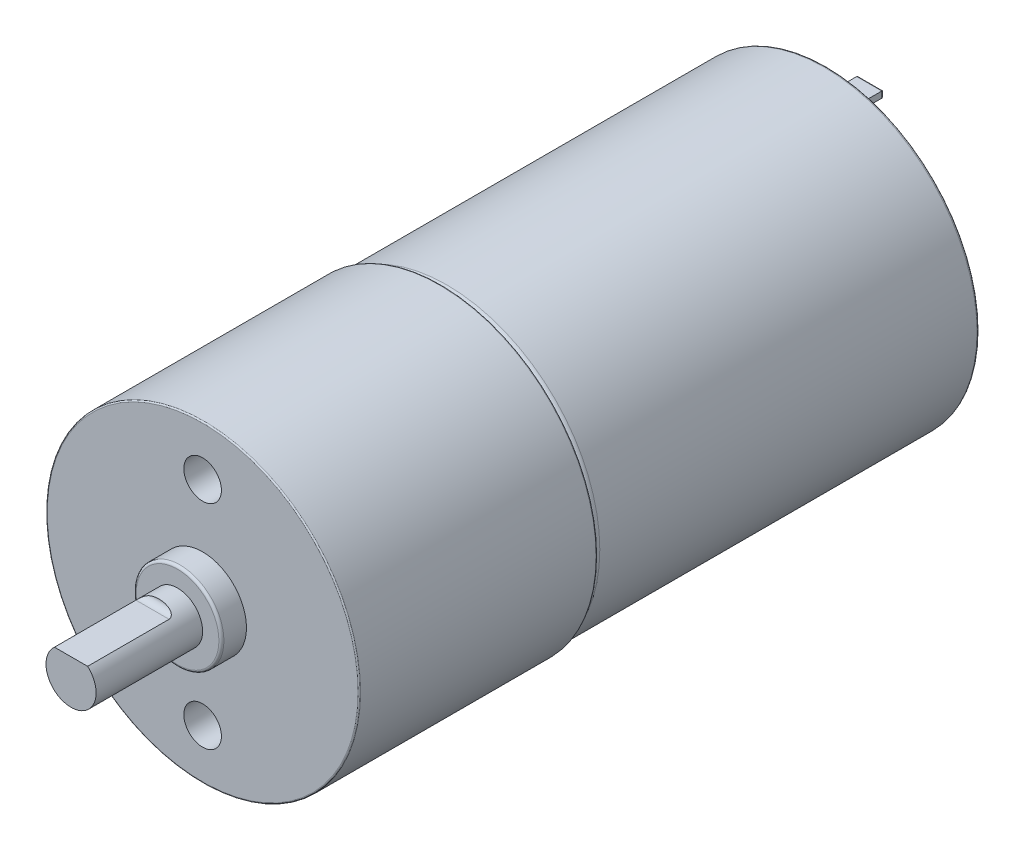
from build123d import *

# Parameters (mm, degrees)
IZIM2_R                     = 12.2
Y_KSEKLIK_EKSTR_ZYON1_DEPTH = 30.8
RADYUS1_R                   = 0.5
IZIM3_R                     = 12.5
Y_KSEKLIK_EKSTR_ZYON2_DEPTH = 19
IZIM4_R                     = 3.5
Y_KSEKLIK_EKSTR_ZYON3_DEPTH = 2
IZIM5_R                     = 3.225
Y_KSEKLIK_EKSTR_ZYON4_DEPTH = 1.7
IZIM6_R                     = 2
Y_KSEKLIK_EKSTR_ZYON5_DEPTH = 8.5
KES_EKSTR_ZYON1_START       = -7
KES_EKSTR_ZYON1_DEPTH       = 7
RADYUS2_R                   = 0.5
RADYUS3_R                   = 0.2
RADYUS4_R                   = 0.3
RADYUS5_R                   = 0.2
RADYUS6_R                   = 0.1
RADYUS7_R                   = 0.1
IZIM8_R                     = 1.5
KES_EKSTR_ZYON2_DEPTH       = 3.5
IZIM9_W                     = 2
IZIM9_H                     = 0.5
Y_KSEKLIK_EKSTR_ZYON8_DEPTH = 3.5
RADYUS8_R                   = 0.1


with BuildPart() as part:
    # Çizim2 → Yükseklik-Ekstrüzyon1 (new body)
    with BuildSketch(Plane.XY):
        with Locations(Location((0, 0, 0), (0, 0, 180))):
            Circle(IZIM2_R)
    extrude(amount=Y_KSEKLIK_EKSTR_ZYON1_DEPTH)

    # Radyus1
    radyus1_edges = [part.edges().sort_by_distance(p)[0] for p in [
        (12.2, 0, 30.8),
    ]]
    fillet(radyus1_edges, radius=RADYUS1_R)

    # Çizim3 → Yükseklik-Ekstrüzyon2 (add)
    with BuildSketch(Plane.XY.offset(30.8)):
        Circle(IZIM3_R)
    extrude(amount=Y_KSEKLIK_EKSTR_ZYON2_DEPTH)

    # Çizim4 → Yükseklik-Ekstrüzyon3 (add)
    with BuildSketch(Plane.XY.offset(49.8)):
        Circle(IZIM4_R)
    extrude(amount=Y_KSEKLIK_EKSTR_ZYON3_DEPTH)

    # Çizim5 → Yükseklik-Ekstrüzyon4 (add)
    with BuildSketch(Plane(origin=(0, 0, 0), x_dir=(-1, 0, 0), z_dir=(0, 0, -1))):
        with Locations(Location((0, 0, 0), (0, 0, 180))):
            Circle(IZIM5_R)
    extrude(amount=Y_KSEKLIK_EKSTR_ZYON4_DEPTH)

    # Çizim6 → Yükseklik-Ekstrüzyon5 (add)
    with BuildSketch(Plane.XY.offset(51.8)):
        Circle(IZIM6_R)
    extrude(amount=Y_KSEKLIK_EKSTR_ZYON5_DEPTH)

    # Çizim7 → Kes-Ekstrüzyon1 (cut)
    with BuildSketch(Plane.XY.offset(60.3).offset(KES_EKSTR_ZYON1_START)):
        with BuildLine():
            Line((-1.322875656, 1.5), (1.322875656, 1.5))
            ThreePointArc((1.322875656, 1.5), (0, 2), (-1.322875656, 1.5))
        make_face()
    extrude(amount=KES_EKSTR_ZYON1_DEPTH, mode=Mode.SUBTRACT)

    # Radyus2
    radyus2_edges = [part.edges().sort_by_distance(p)[0] for p in [
        (0, 1.5, 53.3),
    ]]
    fillet(radyus2_edges, radius=RADYUS2_R - 0.0001)  # a hair under: the kernel refuses the full size

    # Radyus3
    radyus3_edges = [part.edges().sort_by_distance(p)[0] for p in [
        (-3.5, 0, 51.8),
    ]]
    fillet(radyus3_edges, radius=RADYUS3_R)

    # Radyus4
    radyus4_edges = [part.edges().sort_by_distance(p)[0] for p in [
        (-3.225, 0, -1.7),
    ]]
    fillet(radyus4_edges, radius=RADYUS4_R)

    # Radyus5
    radyus5_edges = [part.edges().sort_by_distance(p)[0] for p in [
        (12.2, 0, 0),
    ]]
    fillet(radyus5_edges, radius=RADYUS5_R)

    # Radyus6
    radyus6_edges = [part.edges().sort_by_distance(p)[0] for p in [
        (-12.5, 0, 30.8),
    ]]
    fillet(radyus6_edges, radius=RADYUS6_R)

    # Radyus7
    radyus7_edges = [part.edges().sort_by_distance(p)[0] for p in [
        (-12.5, 0, 49.8),
    ]]
    fillet(radyus7_edges, radius=RADYUS7_R)

    # Çizim8 → Kes-Ekstrüzyon2 (cut)
    with BuildSketch(Plane.XY.offset(49.8)):
        with Locations((0, 8.5)):
            Circle(IZIM8_R)
        with Locations((0, -8.5)):
            Circle(IZIM8_R)
    extrude(amount=-KES_EKSTR_ZYON2_DEPTH, mode=Mode.SUBTRACT)

    # Çizim9 → Yükseklik-Ekstrüzyon8 (add)
    with BuildSketch(Plane(origin=(0, 0, 0), x_dir=(-1, 0, 0), z_dir=(0, 0, -1))):
        with Locations((0, 9)):
            Rectangle(IZIM9_W, IZIM9_H)
        with Locations((0, -9)):
            Rectangle(IZIM9_W, IZIM9_H)
    extrude(amount=Y_KSEKLIK_EKSTR_ZYON8_DEPTH)

    # Radyus8
    radyus8_edges = [part.edges().sort_by_distance(p)[0] for p in [
        (1, 9, -3.5),
        (0, 8.75, -3.5),
        (-1, 9, -3.5),
        (0, 9.25, -3.5),
        (1, -9, -3.5),
        (0, -9.25, -3.5),
        (-1, -9, -3.5),
        (0, -8.75, -3.5),
    ]]
    fillet(radyus8_edges, radius=RADYUS8_R)


solid = part.part
